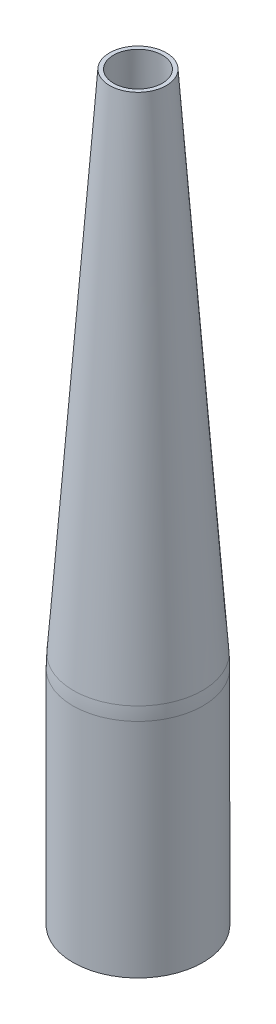
from build123d import *

# Parameters (mm, degrees)
FILLET1_R = 76.2


# Read off the part's stored shape, not the designer's step: Shell1
with BuildPart() as part:
    # Sketch1 → Revolve1 (revolve)
    with BuildSketch(Plane.XY, mode=Mode.PRIVATE) as revolve1_sk:
        Polygon((0, 308.61), (0, 0), (27.051, 0), (27.051, 95.25), (11.811, 308.61), align=None)
    revolve(revolve1_sk.sketch.rotate(Axis((0, 473.964, 0), (0, -1, 0)), 90), axis=Axis((0, 473.964, 0), (0, -1, 0)))

    # Shell1 outline → Shell1 (revolve, cut)
    with BuildSketch(Plane.XY):
        Polygon((25.4, 0), (25.4, 95.191110733), (10.155793624, 308.61), (0, 308.61), (0, 0), align=None)
    revolve(axis=Axis((0, 0, 0), (0, 1, 0)), mode=Mode.SUBTRACT)

    # Fillet1
    # the kernel refuses this fillet: 76.2 mm, written as the material it takes off along each edge
    with BuildSketch(Plane(origin=(0, 95.25, 0), x_dir=(0, 0, 1), z_dir=(1, 0, 0))) as fillet1_piece_1:
        with BuildLine():
            CenterArc((27.051 - FILLET1_R, FILLET1_R * 0.0356688476182), FILLET1_R, 355.91438322, 4.08561678)
            Line((27.051 - FILLET1_R * 0.00254130016926, -FILLET1_R * 0.0355782023697), (27.051 + FILLET1_R * 0.0174078738273, -FILLET1_R * 0.0370031433695))
            Line((27.051 + FILLET1_R * 0.0174078738273, -FILLET1_R * 0.0370031433695), (27.051 + FILLET1_R * 0.02, -FILLET1_R * 0.000713376952364))
            Line((27.051 + FILLET1_R * 0.02, -FILLET1_R * 0.000713376952364), (27.051 + FILLET1_R * 0.02, FILLET1_R * 0.0356688476182))
            Line((27.051 + FILLET1_R * 0.02, FILLET1_R * 0.0356688476182), (27.051, FILLET1_R * 0.0356688476182))
        make_face()
    revolve(axis=Axis((0, 95.25, 0), (0, -1, 0)), mode=Mode.SUBTRACT)


solid = part.part
